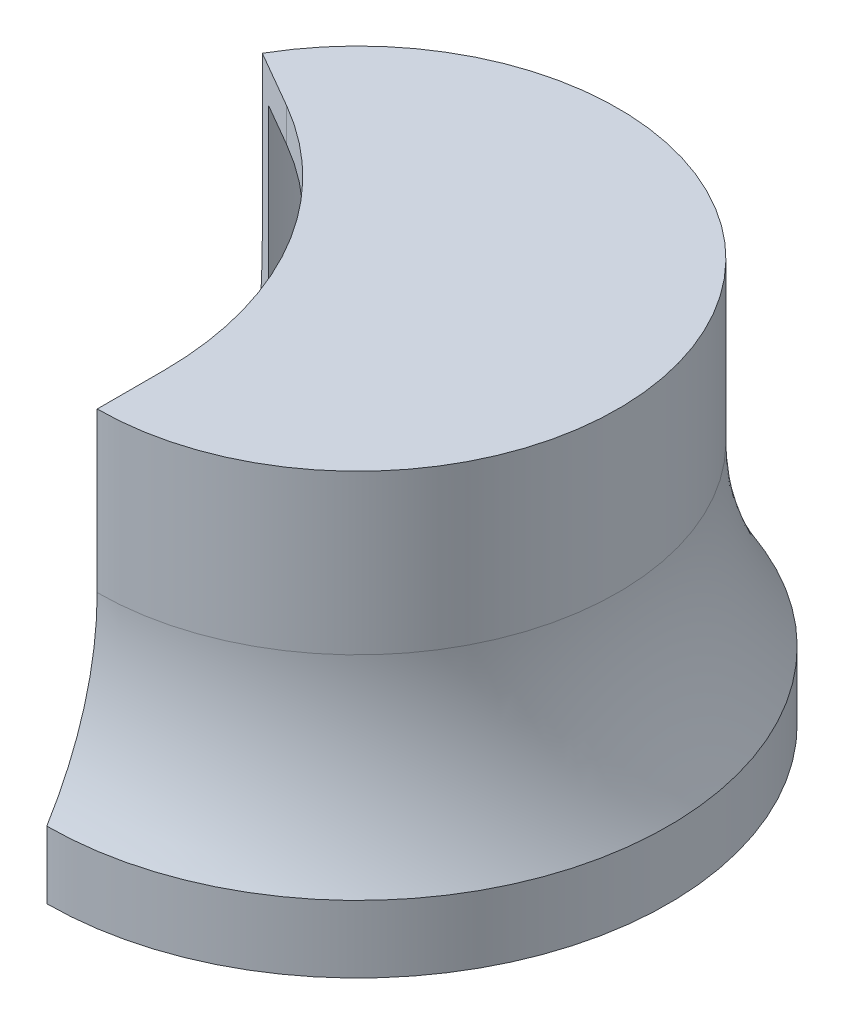
from build123d import *

# Parameters (mm, degrees)
SKETCH1_R           = 18.5
SKETCH1_R_2         = 14.5
BOSS_EXTRUDE2_DEPTH = 2
BOSS_EXTRUDE3_START = -2
SKETCH1_4_R         = 18.5
SKETCH1_4_R_2       = 17
BOSS_EXTRUDE3_DEPTH = 2
SKETCH1_5_R         = 15.5
SKETCH1_5_R_2       = 14.5
BOSS_EXTRUDE4_DEPTH = 20
BOSS_EXTRUDE5_START = 20
SKETCH1_6_R         = 15.5
BOSS_EXTRUDE5_DEPTH = 2
SKETCH2_W           = 20
SKETCH2_H           = 20
CUT_EXTRUDE3_DEPTH  = 31
FILLET2_R           = 20
FILLET3_ANGLE       = 240


with BuildPart() as part:
    # Sketch1 → Boss-Extrude2 (new body)
    with BuildSketch(Plane(origin=(0, 0, 0), x_dir=(1, 0, 0), z_dir=(0, 1, 0))):
        with Locations(Location((0, 0, 0), (0, 0, 270))):
            Circle(SKETCH1_R)
        with Locations(Location((0, 0, 0), (0, 0, 270))):
            Circle(SKETCH1_R_2, mode=Mode.SUBTRACT)
    extrude(amount=BOSS_EXTRUDE2_DEPTH)

    # Sketch1<4> → Boss-Extrude3 (add)
    with BuildSketch(Plane(origin=(0, 0, 0), x_dir=(1, 0, 0), z_dir=(0, 1, 0)).offset(BOSS_EXTRUDE3_START)):
        with Locations(Location((0, 0, 0), (0, 0, 270))):
            Circle(SKETCH1_4_R)
        with Locations(Location((0, 0, 0), (0, 0, 270))):
            Circle(SKETCH1_4_R_2, mode=Mode.SUBTRACT)
    extrude(amount=BOSS_EXTRUDE3_DEPTH)

    # Sketch1<5> → Boss-Extrude4 (add)
    with BuildSketch(Plane(origin=(0, 0, 0), x_dir=(1, 0, 0), z_dir=(0, 1, 0))):
        with Locations(Location((0, 0, 0), (0, 0, 270))):
            Circle(SKETCH1_5_R)
        with Locations(Location((0, 0, 0), (0, 0, 270))):
            Circle(SKETCH1_5_R_2, mode=Mode.SUBTRACT)
    extrude(amount=BOSS_EXTRUDE4_DEPTH)

    # Sketch1<6> → Boss-Extrude5 (add)
    with BuildSketch(Plane(origin=(0, 0, 0), x_dir=(1, 0, 0), z_dir=(0, 1, 0)).offset(BOSS_EXTRUDE5_START)):
        with Locations(Location((0, 0, 0), (0, 0, 270))):
            Circle(SKETCH1_6_R)
    extrude(amount=BOSS_EXTRUDE5_DEPTH)

    # Sketch2 → Cut-Extrude3 (cut, symmetric)
    with BuildSketch(Plane(origin=(0, 0, 0), x_dir=(1, 0, 0), z_dir=(0, 1, 0))):
        with Locations((-10, -10)):
            Rectangle(SKETCH2_W, SKETCH2_H)
        Polygon((0, 0), (-20, 11.547005384), (-20, 0), align=None)
    extrude(amount=CUT_EXTRUDE3_DEPTH, both=True, mode=Mode.SUBTRACT)

    # Fillet2
    fillet2_edges = [part.edges().sort_by_distance(p)[0] for p in [
        (0, 21, 0),
    ]]
    fillet(fillet2_edges, radius=FILLET2_R)

    # Fillet3: read off the stored shape, not the designer's step
    # Fillet3 outline → Fillet3 (revolve)
    with BuildSketch(Plane.ZY):
        with BuildLine():
            Line((15.5, 2), (18.5, 2))
            ThreePointArc((18.5, 2), (16.264615938, 7.058428178), (15.5, 12.535653753))
            Line((15.5, 12.535653753), (15.5, 2))
        make_face()
    revolve(axis=Axis((0, 0, 0), (0, 1, 0)), revolution_arc=FILLET3_ANGLE)


solid = part.part
